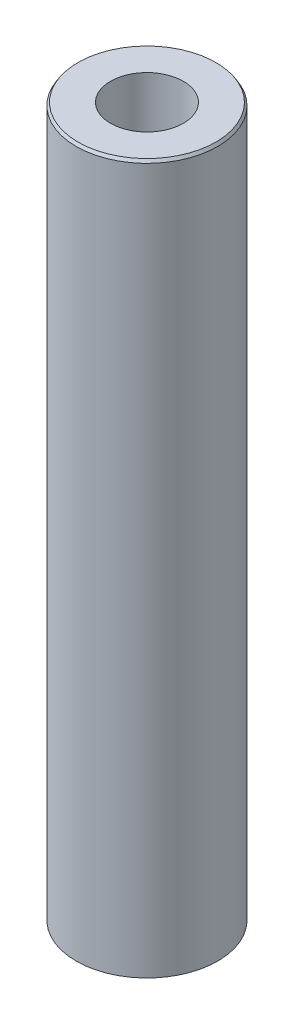
from build123d import *
from OCP.BRepFilletAPI import BRepFilletAPI_MakeChamfer

# Parameters (mm, degrees)
SKETCH1_R           = 27.5
BOSS_EXTRUDE1_DEPTH = 275.916503753
SKETCH2_R           = 14.152849675
CUT_EXTRUDE1_DEPTH  = 279.643889298
CHAMFER1_SIZE       = 1.11181415
CHAMFER1_SIZE2      = 0.714497342


with BuildPart() as part:
    # Sketch1 → Boss-Extrude1 (new body)
    with BuildSketch(Plane(origin=(0, 0, 0), x_dir=(1, 0, 0), z_dir=(0, 1, 0))):
        Circle(SKETCH1_R)
    extrude(amount=BOSS_EXTRUDE1_DEPTH)

    # Sketch2 → Cut-Extrude1 (cut, through all)
    with BuildSketch(Plane(origin=(0, 0, 0), x_dir=(1, 0, 0), z_dir=(0, 1, 0))):
        Circle(SKETCH2_R)
    extrude(amount=CUT_EXTRUDE1_DEPTH, mode=Mode.SUBTRACT)

    # Chamfer1: one chamfer whose edges measure the first distance from different faces: ONE call of the kernel's chamfer builder (chamfer() names one face for all edges)
    chamfer1_edges_1 = [part.edges().sort_by_distance(p)[0] for p in [
        (-27.5, 275.916503753, 0),
    ]]
    chamfer1_side_1 = [part.faces().sort_by_distance(p)[0] for p in [
        (-27.5, 137.958251876, 0),
    ]]
    chamfer1_edges_2 = [part.edges().sort_by_distance(p)[0] for p in [
        (-27.5, 0, 0),
    ]]
    chamfer1_side_2 = [part.faces().sort_by_distance(p)[0] for p in [
        (-26.722182541, 0, 0),
    ]]
    chamfer1 = BRepFilletAPI_MakeChamfer(part.part.solid().wrapped)
    for e in chamfer1_edges_1:
        chamfer1.Add(CHAMFER1_SIZE, CHAMFER1_SIZE2, e.wrapped, chamfer1_side_1[0].wrapped)  # the first distance lies on this face
    for e in chamfer1_edges_2:
        chamfer1.Add(CHAMFER1_SIZE, CHAMFER1_SIZE2, e.wrapped, chamfer1_side_2[0].wrapped)  # the first distance lies on this face
    add(Compound.cast(chamfer1.Shape()), mode=Mode.REPLACE)


solid = part.part
